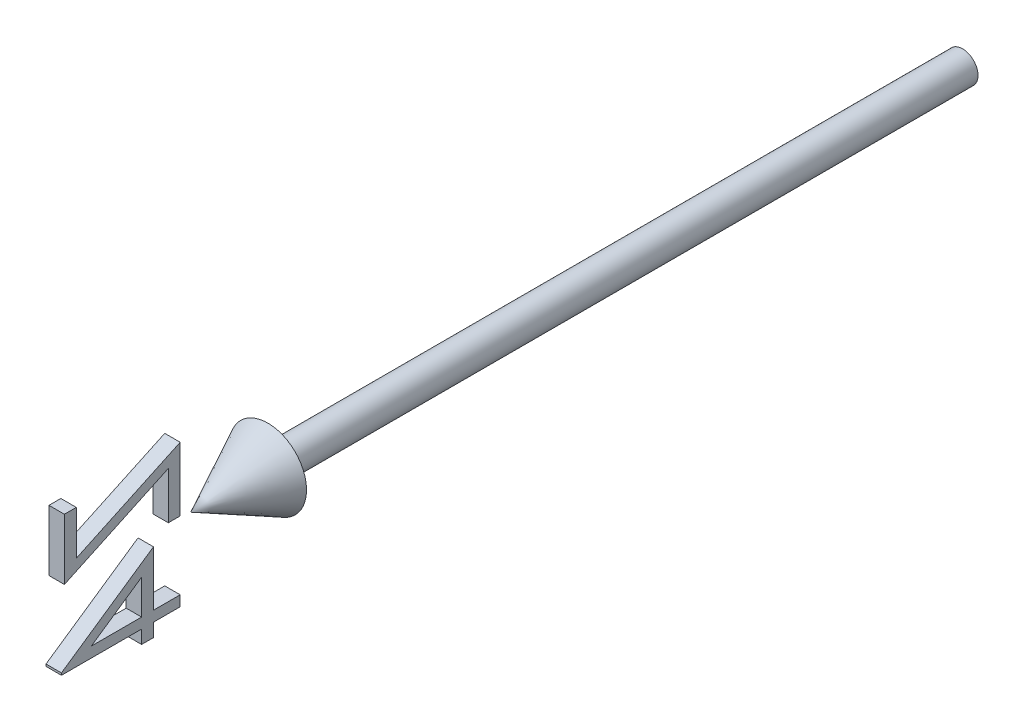
from build123d import *

# Parameters (mm, degrees)
BOSS_EXTRUDE1_DEPTH        = 1
BOSS_EXTRUDE1_DEPTH_BACK   = 1
BOSS_EXTRUDE1_2_DEPTH      = 1
BOSS_EXTRUDE1_2_DEPTH_BACK = 1


with BuildPart() as part:
    # Sketch2 → Revolve1 (revolve)
    with BuildSketch(Plane(origin=(0, 0, 0), x_dir=(1, 0, 0), z_dir=(0, 1, 0))):
        Polygon((0, -100), (5, -90), (2, -90), (2, 0), (0, 0), align=None)
    revolve(axis=Axis((0, 0, -41.949952025), (0, 0, 1)))


with BuildPart() as body_2:
    # Sketch3 → Boss-Extrude1 (new, two sides: drawn at the far end of the back side and taken through both)
    with BuildSketch(Plane(origin=(0, 0, 0), x_dir=(0, -1, 0), z_dir=(1, 0, 0)).offset(-BOSS_EXTRUDE1_DEPTH_BACK)):
        Polygon((-8.958586521, -115.829050545), (-8.958586521, -117.367512083), (-1.073971137, -117.367512083), (-7.366038444, -103.905973622), (-1.266278829, -103.905973622), (-1.266278829, -102.367512083), (-9.535509598, -102.367512083), (-3.243442291, -115.829050545), align=None)
    extrude(amount=BOSS_EXTRUDE1_DEPTH + BOSS_EXTRUDE1_DEPTH_BACK)


with BuildPart() as body_3:
    # Sketch3 → Boss-Extrude1 2 (new, two sides: drawn at the far end of the back side and taken through both)
    with BuildSketch(Plane(origin=(0, 0, 0), x_dir=(0, -1, 0), z_dir=(1, 0, 0)).offset(-BOSS_EXTRUDE1_2_DEPTH_BACK)):
        Polygon((8.652591363, -117.752127468), (8.926028863, -117.752127468), (8.926028863, -107.367512083), (10.656798094, -107.367512083), (10.656798094, -105.829050545), (8.926028863, -105.829050545), (8.926028863, -102.367512083), (7.579875017, -102.367512083), (7.579875017, -105.829050545), (0.464490402, -105.829050545), align=None)
        Polygon((7.579875017, -107.367512083), (7.579875017, -113.88193516), (3.108721171, -107.367512083), align=None, mode=Mode.SUBTRACT)
    extrude(amount=BOSS_EXTRUDE1_2_DEPTH + BOSS_EXTRUDE1_2_DEPTH_BACK)


solid = Compound([part.part, body_2.part, body_3.part])
